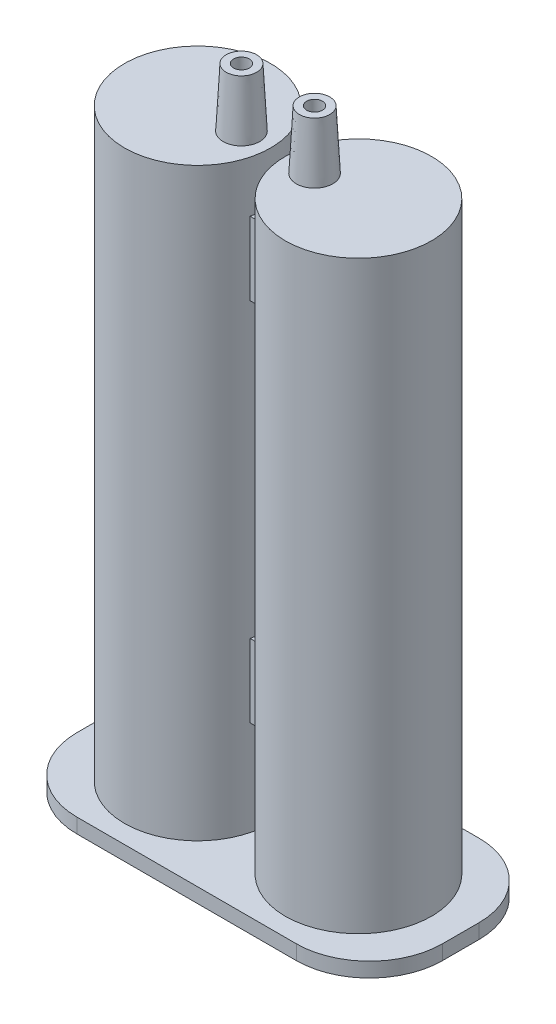
from build123d import *
from build123d.topology import SkipClean

# Parameters (mm, degrees)
BOSS_EXTRUDE1_DEPTH           = 2
BOSS_EXTRUDE2_DEPTH           = 80
SKETCH3_R                     = 2.5
BOSS_EXTRUDE3_DEPTH           = 8
BOSS_EXTRUDE3_DRAFT           = 3
BOSS_EXTRUDE3_PROFILE_2_DEPTH = 8
BOSS_EXTRUDE3_PROFILE_2_DRAFT = 3
SHELL2_START                  = 1
SHELL2_OUTLINE_R              = 9
SHELL2_DEPTH                  = 80
CUT_EXTRUDE1_DEPTH            = 93.332280474
BOSS_EXTRUDE4_DEPTH           = 5
BOSS_EXTRUDE5_DEPTH           = 5


with BuildPart() as part:
    # Sketch1 → Boss-Extrude1 (new body)
    with BuildSketch(Plane(origin=(0, 0, 0), x_dir=(1, 0, 0), z_dir=(0, 1, 0))):
        with BuildLine():
            Line((-15, -12.5), (15, -12.5))
            ThreePointArc((15, -12.5), (22.071067812, -9.571067812), (25, -2.5))
            Line((25, -2.5), (25, 2.5))
            ThreePointArc((25, 2.5), (22.071067812, 9.571067812), (15, 12.5))
            Line((15, 12.5), (-15, 12.5))
            ThreePointArc((-15, 12.5), (-22.071067812, 9.571067812), (-25, 2.5))
            Line((-25, 2.5), (-25, -2.5))
            ThreePointArc((-25, -2.5), (-22.071067812, -9.571067812), (-15, -12.5))
        make_face()
    extrude(amount=BOSS_EXTRUDE1_DEPTH)

    # Sketch2 → Boss-Extrude2 (add)
    with BuildSketch(Plane(origin=(0, 2, 0), x_dir=(1, 0, 0), z_dir=(0, 1, 0))):
        with BuildLine():
            ThreePointArc((-20, 0), (-11, 9), (-2, 0))
            Line((-2, 0), (-1, 0))
            ThreePointArc((-1, 0), (-11, 10), (-21, 0))
            Line((-21, 0), (-20, 0))
        make_face()
        with BuildLine():
            Line((-1, 0), (-2, 0))
            ThreePointArc((-2, 0), (-11, -9), (-20, 0))
            Line((-20, 0), (-21, 0))
            ThreePointArc((-21, 0), (-11, -10), (-1, 0))
        make_face()
        with BuildLine():
            ThreePointArc((21, 0), (11, 10), (1, 0))
            Line((1, 0), (2, 0))
            ThreePointArc((2, 0), (11, 9), (20, 0))
            Line((20, 0), (21, 0))
        make_face()
        with BuildLine():
            Line((2, 0), (1, 0))
            ThreePointArc((1, 0), (11, -10), (21, 0))
            Line((21, 0), (20, 0))
            ThreePointArc((20, 0), (11, -9), (2, 0))
        make_face()
        with BuildLine():
            ThreePointArc((20, 0), (11, 9), (2, 0))
            Line((2, 0), (20, 0))
        make_face()
        with BuildLine():
            Line((20, 0), (2, 0))
            ThreePointArc((2, 0), (11, -9), (20, 0))
        make_face()
        with BuildLine():
            ThreePointArc((-20, 0), (-11, -9), (-2, 0))
            Line((-2, 0), (-20, 0))
        make_face()
        with BuildLine():
            Line((-20, 0), (-2, 0))
            ThreePointArc((-2, 0), (-11, 9), (-20, 0))
        make_face()
    extrude(amount=BOSS_EXTRUDE2_DEPTH)


with BuildPart() as boss_extrude3_tool:
    # Sketch3 → Boss-Extrude3 (with draft: the straight prism first)
    with BuildSketch(Plane(origin=(0, 82, 0), x_dir=(1, 0, 0), z_dir=(0, 1, 0))):
        with Locations((-5, 0)):
            Circle(SKETCH3_R)
    extrude(amount=BOSS_EXTRUDE3_DEPTH)
    # Boss-Extrude3: the draft: its side faces are tilted about the plane it starts from
    boss_extrude3_sides = [boss_extrude3_tool.faces().sort_by_distance(p)[0] for p in [
        (-7.5, 86, 0),
    ]]
    draft(boss_extrude3_sides, Plane(origin=(0, 82, 0), x_dir=(1, 0, 0), z_dir=(0, 1, 0)), BOSS_EXTRUDE3_DRAFT)


with BuildPart() as part_1:
    add(part.part)

    # Boss-Extrude3: add boss_extrude3_tool
    add(boss_extrude3_tool.part)


with BuildPart() as boss_extrude3_profile_2_tool:
    # Sketch3 → Boss-Extrude3 profile 2 (with draft: the straight prism first)
    with BuildSketch(Plane(origin=(0, 82, 0), x_dir=(1, 0, 0), z_dir=(0, 1, 0))):
        with Locations((5, 0)):
            Circle(SKETCH3_R)
    extrude(amount=BOSS_EXTRUDE3_PROFILE_2_DEPTH)
    # Boss-Extrude3 profile 2: the draft: its side faces are tilted about the plane it starts from
    boss_extrude3_profile_2_sides = [boss_extrude3_profile_2_tool.faces().sort_by_distance(p)[0] for p in [
        (2.5, 86, 0),
    ]]
    draft(boss_extrude3_profile_2_sides, Plane(origin=(0, 82, 0), x_dir=(1, 0, 0), z_dir=(0, 1, 0)), BOSS_EXTRUDE3_PROFILE_2_DRAFT)


with BuildPart() as part_2:
    add(part_1.part)

    # Boss-Extrude3 profile 2: add boss_extrude3_profile_2_tool
    add(boss_extrude3_profile_2_tool.part)

    # Shell2: read off the stored shape, not the designer's step
    # Shell2 outline → Shell2 (cut)
    with BuildSketch(Plane(origin=(0, 0, 0), x_dir=(1, 0, 0), z_dir=(0, 1, 0)).offset(SHELL2_START)):
        with Locations((11, 0)):
            Circle(SHELL2_OUTLINE_R)
        with Locations((-11, 0)):
            Circle(SHELL2_OUTLINE_R)
    extrude(amount=SHELL2_DEPTH, mode=Mode.SUBTRACT)

    # Shell2 2: loft between two sections, ruled curve by curve
    shell2_2_from = [
        Edge.make_three_point_arc((5, 90, 1.07936542), (3.92063458, 90, 0), (5, 90, -1.07936542)),
        Edge.make_three_point_arc((5, 90, -1.07936542), (6.07936542, 90, 0), (5, 90, 1.07936542)),
    ]
    shell2_2_to = [
        Edge.make_three_point_arc((5, 81, 1.551035433), (3.448964567, 81, 0), (5, 81, -1.551035433)),
        Edge.make_three_point_arc((5, 81, -1.551035433), (6.551035433, 81, 0), (5, 81, 1.551035433)),
    ]
    shell2_2 = Solid(Shell([*[Face.make_surface_from_curves(shell2_2_from[k], shell2_2_to[k]) for k in range(2)], Face(Wire(shell2_2_from)), Face(Wire(shell2_2_to))]))
    add(shell2_2, mode=Mode.SUBTRACT)

    # Shell2 3: loft between two sections, ruled curve by curve
    shell2_3_from = [
        Edge.make_three_point_arc((-5, 90, 1.07936542), (-6.07936542, 90, 0), (-5, 90, -1.07936542)),
        Edge.make_three_point_arc((-5, 90, -1.07936542), (-3.92063458, 90, 0), (-5, 90, 1.07936542)),
    ]
    shell2_3_to = [
        Edge.make_three_point_arc((-5, 81, 1.551035433), (-6.551035433, 81, 0), (-5, 81, -1.551035433)),
        Edge.make_three_point_arc((-5, 81, -1.551035433), (-3.448964567, 81, 0), (-5, 81, 1.551035433)),
    ]
    shell2_3 = Solid(Shell([*[Face.make_surface_from_curves(shell2_3_from[k], shell2_3_to[k]) for k in range(2)], Face(Wire(shell2_3_from)), Face(Wire(shell2_3_to))]))
    add(shell2_3, mode=Mode.SUBTRACT)

    # Sketch2<3> → Cut-Extrude1 (cut, through all)
    with SkipClean():  # the faces are left unmerged after this step: merging them gives an invalid solid
        with BuildSketch(Plane(origin=(0, 2, 0), x_dir=(1, 0, 0), z_dir=(0, 1, 0))):
            with BuildLine():
                ThreePointArc((-20, 0), (-11, -9), (-2, 0))
                Line((-2, 0), (-20, 0))
            make_face()
            with BuildLine():
                Line((-20, 0), (-2, 0))
                ThreePointArc((-2, 0), (-11, 9), (-20, 0))
            make_face()
            with BuildLine():
                ThreePointArc((20, 0), (11, 9), (2, 0))
                Line((2, 0), (20, 0))
            make_face()
            with BuildLine():
                Line((20, 0), (2, 0))
                ThreePointArc((2, 0), (11, -9), (20, 0))
            make_face()
        extrude(amount=-CUT_EXTRUDE1_DEPTH, mode=Mode.SUBTRACT)

    # Sketch4 → Boss-Extrude4 (add, symmetric)
    with SkipClean():  # the faces are left unmerged after this step: merging them gives an invalid solid
        with BuildSketch(Plane(origin=(0, 20, 0), x_dir=(1, 0, 0), z_dir=(0, 1, 0))):
            with BuildLine():
                Line((1, 0), (-1, 0))
                ThreePointArc((-1, 0), (-1.079703037, -1.260042925), (-1.317541634, -2.5))
                Line((-1.317541634, -2.5), (1.317541634, -2.5))
                ThreePointArc((1.317541634, -2.5), (1.079703037, -1.260042925), (1, 0))
            make_face()
            with BuildLine():
                ThreePointArc((-1.317541634, 2.5), (-1.079703037, 1.260042925), (-1, 0))
                Line((-1, 0), (1, 0))
                ThreePointArc((1, 0), (1.079703037, 1.260042925), (1.317541634, 2.5))
                Line((1.317541634, 2.5), (-1.317541634, 2.5))
            make_face()
        extrude(amount=BOSS_EXTRUDE4_DEPTH, both=True)

    # Sketch7 → Boss-Extrude5 (add, symmetric)
    with SkipClean():  # the faces are left unmerged after this step: merging them gives an invalid solid
        with BuildSketch(Plane(origin=(0, 70, 0), x_dir=(1, 0, 0), z_dir=(0, 1, 0))):
            with BuildLine():
                ThreePointArc((-1.317541634, 2.5), (-1.079703037, 1.260042925), (-1, 0))
                Line((-1, 0), (1, 0))
                ThreePointArc((1, 0), (1.079703037, 1.260042925), (1.317541634, 2.5))
                Line((1.317541634, 2.5), (-1.317541634, 2.5))
            make_face()
            with BuildLine():
                Line((1, 0), (-1, 0))
                ThreePointArc((-1, 0), (-1.079703037, -1.260042925), (-1.317541634, -2.5))
                Line((-1.317541634, -2.5), (1.317541634, -2.5))
                ThreePointArc((1.317541634, -2.5), (1.079703037, -1.260042925), (1, 0))
            make_face()
        extrude(amount=BOSS_EXTRUDE5_DEPTH, both=True)


solid = part_2.part
